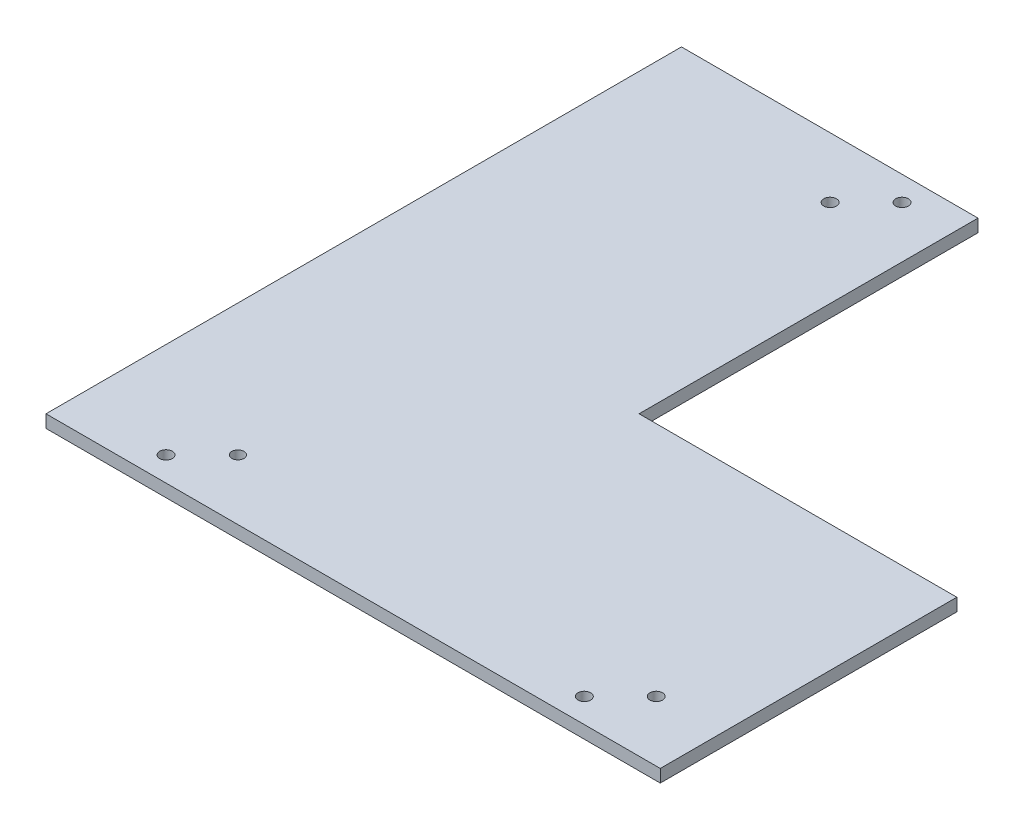
from build123d import *

# Parameters (mm, degrees)
SKETCH1_R           = 1.5
SKETCH1_R_2         = 1.44463942
BOSS_EXTRUDE1_DEPTH = 3


with BuildPart() as part:
    # Sketch1 → Boss-Extrude1 (new body)
    with BuildSketch(Plane(origin=(0, 0, 0), x_dir=(1, 0, 0), z_dir=(0, 1, 0))):
        Polygon((-72.5, -35), (72.5, -35), (72.5, 35), (-2.5, 35), (-2.5, 115), (-72.5, 115), (-72.5, 35), align=None)
        with Locations((-49.926368805, -29.242640687)):
            Circle(SKETCH1_R, mode=Mode.SUBTRACT)
        with Locations((-41.441087431, -20.757359313)):
            Circle(SKETCH1_R_2, mode=Mode.SUBTRACT)
        with Locations((48.815465916, -29.242640687)):
            Circle(SKETCH1_R, mode=Mode.SUBTRACT)
        with Locations((57.30074729, -20.757359313)):
            Circle(SKETCH1_R, mode=Mode.SUBTRACT)
        with Locations((-23.163553362, 100.757359313)):
            Circle(SKETCH1_R, mode=Mode.SUBTRACT)
        with Locations((-14.678271988, 109.242640687)):
            Circle(SKETCH1_R, mode=Mode.SUBTRACT)
    extrude(amount=BOSS_EXTRUDE1_DEPTH)


solid = part.part
